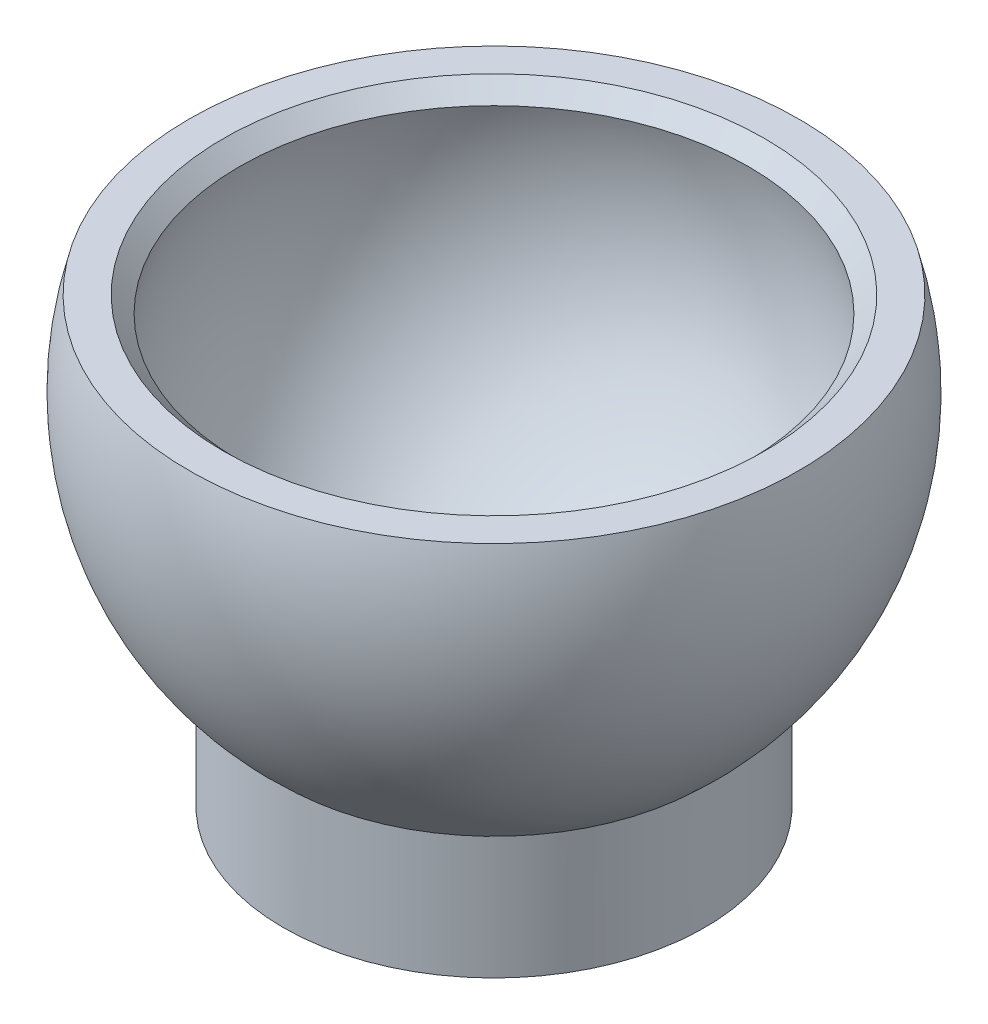
from build123d import *

# Parameters (mm, degrees)
BOSS_EXTRUDE1_REACH      = 44.981
BOSS_EXTRUDE1_END_RADIUS = 15
BOSS_EXTRUDE1_START      = -17
SKETCH2_R                = 10
CHAMFER1_SIZE            = 1


with BuildPart() as part:
    # Sketch1 → Revolve1 (revolve)
    with BuildSketch(Plane.XY):
        with BuildLine():
            Line((11.842719282, 4), (14.456832295, 4))
            ThreePointArc((14.456832295, 4), (11.937336386, -9.082951062), (0, -15))
            Line((0, -15), (0, -12.5))
            ThreePointArc((0, -12.5), (10.155048006, -7.288689869), (11.842719282, 4))
        make_face()
    revolve(axis=Axis((0, 23.994682016, 0), (0, -1, 0)))

    # Boss-Extrude1: up to this sphere (the profile starts outside it)
    boss_extrude1_end = Location((0, 0, 0)) * Sphere(BOSS_EXTRUDE1_END_RADIUS, mode=Mode.PRIVATE)
    # Sketch2 → Boss-Extrude1 (add, up to the surface)
    with BuildSketch(Plane(origin=(0, 0, 0), x_dir=(1, 0, 0), z_dir=(0, 1, 0)).offset(BOSS_EXTRUDE1_START), mode=Mode.PRIVATE) as boss_extrude1_sk1:
        with Locations(Location((0, 0, 0), (0, 0, 180))):
            Circle(SKETCH2_R)
    boss_extrude1_tool1 = extrude(boss_extrude1_sk1.sketch, amount=BOSS_EXTRUDE1_REACH, mode=Mode.PRIVATE) - boss_extrude1_end
    add(boss_extrude1_tool1.solids().sort_by_distance((0, -17, 0))[0])

    # Chamfer1
    # the kernel refuses this chamfer: 1, 0.789005964 mm, written as the material it takes off along each edge
    with BuildSketch(Plane(origin=(0, 4, 0), x_dir=(1, 0, 0), z_dir=(0, 0, -1))) as chamfer1_piece_1:
        with BuildLine():
            Line((11.842719282 + CHAMFER1_SIZE, 0), (12.074893395, 0.767825887))
            ThreePointArc((12.074893395, 0.767825887), (11.967702274, 0.391107888), (11.842719282, 0))
            Line((11.842719282, 0), (11.842719282 + CHAMFER1_SIZE, 0))
        make_face()
    revolve(axis=Axis((0, 4, 0), (0, -1, 0)), mode=Mode.SUBTRACT)


solid = part.part
